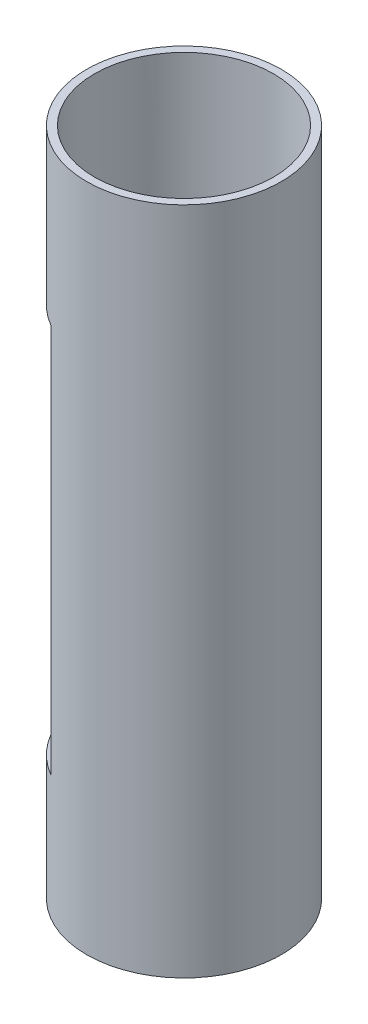
from build123d import *

# Parameters (mm, degrees)
SKETCH_1_R          = 25
SKETCH_1_R_2        = 23
EXTRUDE_1_DEPTH     = 172
CUT_EXTRUDE_1_DEPTH = 100


with BuildPart() as part:
    # Эскиз1 → Бобышка-Вытянуть1 (new body)
    with BuildSketch(Plane(origin=(0, 0, 0), x_dir=(1, 0, 0), z_dir=(0, 1, 0))):
        Circle(SKETCH_1_R)
        Circle(SKETCH_1_R_2, mode=Mode.SUBTRACT)
    extrude(amount=EXTRUDE_1_DEPTH)

    # Эскиз2 → Вырез-Вытянуть1 (cut)
    with BuildSketch(Plane(origin=(0, 32, 0), x_dir=(-1, 0, 0), z_dir=(0, -1, 0))):
        Polygon((0, 0), (29.61457633, 51.293950849), (33.452789958, -57.941931861), align=None)
    extrude(amount=-CUT_EXTRUDE_1_DEPTH, mode=Mode.SUBTRACT)


solid = part.part
